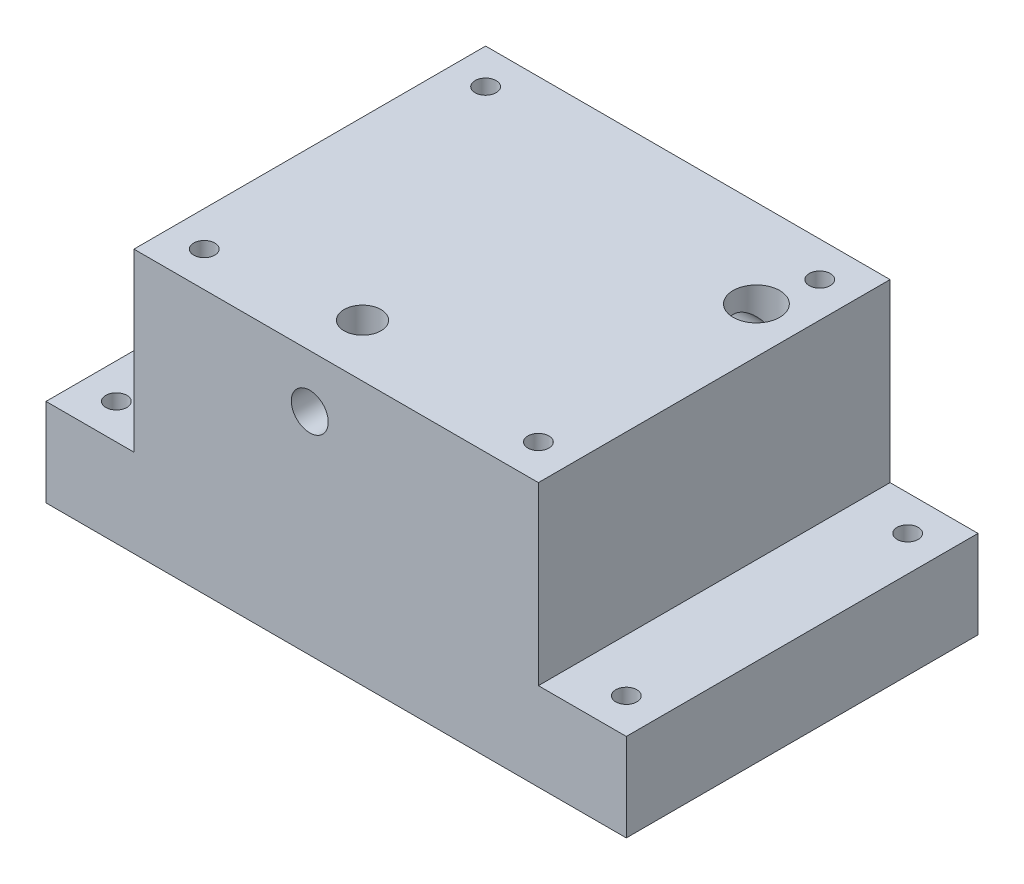
from build123d import *

# Parameters (mm, degrees)
SKETCH_1_W              = 330
SKETCH_1_H              = 200
EXTRUDE_1_DEPTH         = 50
SKETCH_2_W              = 230
SKETCH_2_H              = 200
EXTRUDE_2_DEPTH         = 100
HOLE_WIZARD_M30_1_D     = 26.5
HOLE_WIZARD_M30_1_DEPTH = 32.038596798
HOLE_WIZARD_M30_1_TIP   = 7.961403202
HOLE_WIZARD_M24_3_D     = 21
HOLE_WIZARD_M24_3_DEPTH = 143.6909635
HOLE_WIZARD_M24_3_TIP   = 6.3090365
HOLE_WIZARD_M14_4_D     = 12
MIRROR_5_COPY_1_D       = 12
HOLE_WIZARD_M24_5_D     = 21
HOLE_WIZARD_M24_5_DEPTH = 33.6909635
HOLE_WIZARD_M24_5_TIP   = 6.3090365


with BuildPart() as part:
    # 草图1 → 凸台-拉伸1 (new body)
    with BuildSketch(Plane(origin=(0, 0, 0), x_dir=(1, 0, 0), z_dir=(0, 1, 0))):
        Rectangle(SKETCH_1_W, SKETCH_1_H)
    extrude(amount=EXTRUDE_1_DEPTH)

    # 草图2 → 凸台-拉伸2 (add)
    with BuildSketch(Plane(origin=(0, 50, 0), x_dir=(1, 0, 0), z_dir=(0, 1, 0))):
        Rectangle(SKETCH_2_W, SKETCH_2_H)
    extrude(amount=EXTRUDE_2_DEPTH)

    # M30 螺纹孔的螺纹孔钻头1
    with Locations(Plane(origin=(0, 150, 0), x_dir=(1, 0, 0), z_dir=(0, 1, 0))):
        with Locations((89, 50)):
            Hole(HOLE_WIZARD_M30_1_D / 2, depth=HOLE_WIZARD_M30_1_DEPTH)
            with Locations((0, 0, -(HOLE_WIZARD_M30_1_DEPTH + HOLE_WIZARD_M30_1_TIP / 2))):  # 118° drill point
                Cone(0, HOLE_WIZARD_M30_1_D / 2, HOLE_WIZARD_M30_1_TIP, mode=Mode.SUBTRACT)

    # M24 螺纹孔的螺纹孔钻头3
    with Locations(Plane.XY.offset(100)):
        with Locations((-15, 120)):
            Hole(HOLE_WIZARD_M24_3_D / 2, depth=HOLE_WIZARD_M24_3_DEPTH)
            with Locations((0, 0, -(HOLE_WIZARD_M24_3_DEPTH + HOLE_WIZARD_M24_3_TIP / 2))):  # 118° drill point
                Cone(0, HOLE_WIZARD_M24_3_D / 2, HOLE_WIZARD_M24_3_TIP, mode=Mode.SUBTRACT)

    # 草图23 → M30 螺纹孔的螺纹孔钻头2 (revolve, cut)
    with BuildSketch(Plane(origin=(89, 125, -50), x_dir=(0, 0, -1), z_dir=(0, 1, 0))):
        Polygon((0, 0), (0, 116), (13.25, 108.038596798), (13.25, 0), align=None)
    revolve(axis=Axis((95.35, 125, -50), (-1, 0, 0)), mode=Mode.SUBTRACT)

    # 草图32 → M14 螺纹孔的螺纹孔钻头3 (revolve, cut)
    with BuildSketch(Plane(origin=(-95, 150, -80), x_dir=(0, 0, 1), z_dir=(1, 0, 0))):
        Polygon((0, 0), (0, 25), (6, 21.394836286), (6, 0), align=None)
    hole_wizard_m14_3 = revolve(axis=Axis((-95, 156.35, -80), (0, -1, 0)), mode=Mode.SUBTRACT)

    # 镜向1: M14 螺纹孔的螺纹孔钻头3 across plane
    add(hole_wizard_m14_3.mirror(Plane.XY), mode=Mode.SUBTRACT)

    # 镜向2: M14 螺纹孔的螺纹孔钻头3 across plane
    add(hole_wizard_m14_3.mirror(Plane.ZY), mode=Mode.SUBTRACT)

    # 镜向2 copy 1 sketch → 镜向2 copy 1 (revolve, cut)
    with BuildSketch(Plane(origin=(95, 150, 80), x_dir=(0, 0, -1), z_dir=(-1, 0, 0))):
        Polygon((0, 0), (0, 25), (6, 21.394836286), (6, 0), align=None)
    revolve(axis=Axis((95, 156.35, 80), (0, -1, 0)), mode=Mode.SUBTRACT)

    # M14 螺纹孔的螺纹孔钻头4 (through all)
    with Locations(Plane(origin=(0, 50, 0), x_dir=(1, 0, 0), z_dir=(0, 1, 0))):
        with Locations((-145, 80)):
            hole_wizard_m14_4 = Hole(HOLE_WIZARD_M14_4_D / 2)

    # 镜向3: M14 螺纹孔的螺纹孔钻头4 across plane
    add(hole_wizard_m14_4.mirror(Plane.XY), mode=Mode.SUBTRACT)

    # 镜向5: M14 螺纹孔的螺纹孔钻头4 across plane
    add(hole_wizard_m14_4.mirror(Plane.ZY), mode=Mode.SUBTRACT)

    # 镜向5 copy 1 (through all)
    with Locations(Plane(origin=(0, 50, 0), x_dir=(-1, 0, 0), z_dir=(0, 1, 0))):
        with Locations((-145, 80)):
            Hole(MIRROR_5_COPY_1_D / 2)

    # M24 螺纹孔的螺纹孔钻头5
    with Locations(Plane(origin=(0, 150, 0), x_dir=(1, 0, 0), z_dir=(0, 1, 0))):
        with Locations((-15, -70)):
            Hole(HOLE_WIZARD_M24_5_D / 2, depth=HOLE_WIZARD_M24_5_DEPTH)
            with Locations((0, 0, -(HOLE_WIZARD_M24_5_DEPTH + HOLE_WIZARD_M24_5_TIP / 2))):  # 118° drill point
                Cone(0, HOLE_WIZARD_M24_5_D / 2, HOLE_WIZARD_M24_5_TIP, mode=Mode.SUBTRACT)


solid = part.part
